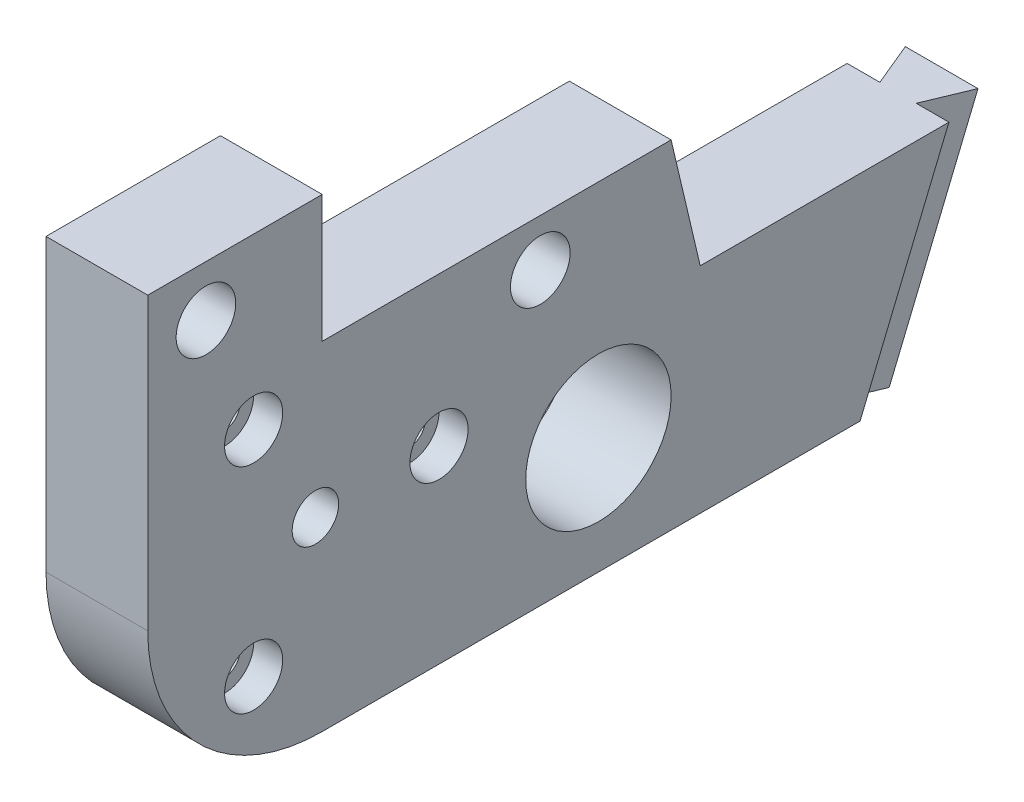
from build123d import *

# Parameters (mm, degrees)
SKETCH1_W                                        = 32
SKETCH1_H                                        = 60
BOSS_EXTRUDE1_DEPTH                              = 7
SKETCH2_W                                        = 51
SKETCH2_H                                        = 8.75
CUT_EXTRUDE1_DEPTH                               = 65.078077374
CUT_EXTRUDE2_DEPTH                               = 65.078077374
F_10_0_10_DIAMETER_HOLE1_D                       = 10
F_10_0_10_DIAMETER_HOLE1_DEPTH                   = 14
M4X0_7_TAPPED_HOLE1_D                            = 2.1
M4X0_7_TAPPED_HOLE1_DEPTH                        = 14
M4X0_7_TAPPED_HOLE1_CBORE_D                      = 4
M4X0_7_TAPPED_HOLE1_CBORE_DEPTH                  = 2
CBORE_FOR_M3_HEX_HEAD_MACHINE_SCREW1_D           = 3.2
CBORE_FOR_M3_HEX_HEAD_MACHINE_SCREW1_CBORE_D     = 10.2
CBORE_FOR_M3_HEX_HEAD_MACHINE_SCREW1_CBORE_DEPTH = 1
F_4_1_4_1_DIAMETER_HOLE1_D                       = 4.1
F_4_1_4_1_DIAMETER_HOLE1_DEPTH                   = 14
F_4_1_4_1_DIAMETER_HOLE2_D                       = 4.1
FILLET3_R                                        = 12
CUT_EXTRUDE3_DEPTH                               = 65.078077374
SKETCH24_W                                       = 59.877724024
SKETCH24_H                                       = 41.345566777
CUT_EXTRUDE4_DEPTH                               = 7


# Read off the part's stored shape, not the designer's step: Mirror1
with BuildPart() as part:
    # Sketch1 → Boss-Extrude1 (new body)
    with BuildSketch(Plane(origin=(-2, 0, 0), x_dir=(0, -1, 0), z_dir=(-1, 0, 0))):
        with Locations((-8, 29)):
            Rectangle(SKETCH1_W, SKETCH1_H)
    extrude(amount=-BOSS_EXTRUDE1_DEPTH)

    # Sketch2 → Cut-Extrude1 (cut, through all)
    with BuildSketch(Plane(origin=(5, 0, 0), x_dir=(0, 0, -1), z_dir=(1, 0, 0))):
        with Locations((-21.5, 19.625)):
            Rectangle(SKETCH2_W, SKETCH2_H)
    extrude(amount=-CUT_EXTRUDE1_DEPTH, mode=Mode.SUBTRACT)

    # Sketch3 → Cut-Extrude2 (cut, through all)
    with BuildSketch(Plane(origin=(5, 0, 0), x_dir=(0, 0, -1), z_dir=(1, 0, 0))):
        Polygon((4, 6.75), (-21, 6.75), (-23, 15.25), (4, 15.25), align=None)
    extrude(amount=-CUT_EXTRUDE2_DEPTH, mode=Mode.SUBTRACT)

    # Ø10.0 (10) Diameter Hole1
    with Locations(Plane.ZY.offset(2)):
        with Locations((28, 0)):
            Hole(F_10_0_10_DIAMETER_HOLE1_D / 2, depth=F_10_0_10_DIAMETER_HOLE1_DEPTH)

    # M4x0.7 Tapped Hole1
    with Locations(Plane.ZY.offset(2)):
        with Locations((38.968179165, 5), (51.718179165, -2.361215932), (51.718179165, 12.361215932)):
            CounterBoreHole(M4X0_7_TAPPED_HOLE1_D / 2, M4X0_7_TAPPED_HOLE1_CBORE_D / 2, M4X0_7_TAPPED_HOLE1_CBORE_DEPTH, depth=M4X0_7_TAPPED_HOLE1_DEPTH)

    # CBORE for M3 Hex Head Machine Screw1 (through all)
    with Locations(Plane(origin=(5, 0, 0), x_dir=(0, 0, -1), z_dir=(1, 0, 0))):
        with Locations((-47.468179165, 5)):
            CounterBoreHole(CBORE_FOR_M3_HEX_HEAD_MACHINE_SCREW1_D / 2, CBORE_FOR_M3_HEX_HEAD_MACHINE_SCREW1_CBORE_D / 2, CBORE_FOR_M3_HEX_HEAD_MACHINE_SCREW1_CBORE_DEPTH)

    # Ø4.1 (4.1) Diameter Hole1
    with Locations(Plane.ZY.offset(2)):
        with Locations((32, 12)):
            Hole(F_4_1_4_1_DIAMETER_HOLE1_D / 2, depth=F_4_1_4_1_DIAMETER_HOLE1_DEPTH)

    # Ø4.1 (4.1) Diameter Hole2 (through all)
    with Locations(Plane(origin=(5, 0, 0), x_dir=(0, 0, -1), z_dir=(1, 0, 0))):
        with Locations((-55, 20.5)):
            Hole(F_4_1_4_1_DIAMETER_HOLE2_D / 2)

    # Fillet3
    fillet3_edges = [part.edges().sort_by_distance(p)[0] for p in [
        (1.5, -8, 59),
    ]]
    fillet(fillet3_edges, radius=FILLET3_R)

    # Cut-Sweep1: sweep along a path in Sketch22
    with BuildLine(Plane.ZY.offset(2)) as cut_sweep1_path:
        Line((-1, -8), (-8.402067684, 9.870172191))
    # Sketch21 → Cut-Sweep1 (sweep, cut)
    with BuildSketch(Plane.XZ.offset(8)):
        Polygon((-2, 10), (0.25, 10), (-1, 7), (-2, 7), align=None)
        Polygon((4, 7), (5, 7), (5, 10), (2.75, 10), align=None)
    sweep(path=cut_sweep1_path.line, mode=Mode.SUBTRACT)

    # Sketch23 → Cut-Extrude3 (cut, through all)
    with BuildSketch(Plane.ZY.offset(2)):
        Polygon((-1, 6.75), (0.890349955, 6.75), (7, -8), (-1, -8), align=None)
    extrude(amount=-CUT_EXTRUDE3_DEPTH, mode=Mode.SUBTRACT)

    # Mirror1: part across plane


with BuildPart() as part_1:
    add(part.part)
    add(part.part.mirror(Plane.ZY.offset(-5)))

    # Sketch24 → Cut-Extrude4 (cut)
    with BuildSketch(Plane.ZY.offset(2)):
        with Locations((29.938862012, 9.46680503)):
            Rectangle(SKETCH24_W, SKETCH24_H)
    extrude(amount=-CUT_EXTRUDE4_DEPTH, mode=Mode.SUBTRACT)


solid = part_1.part
